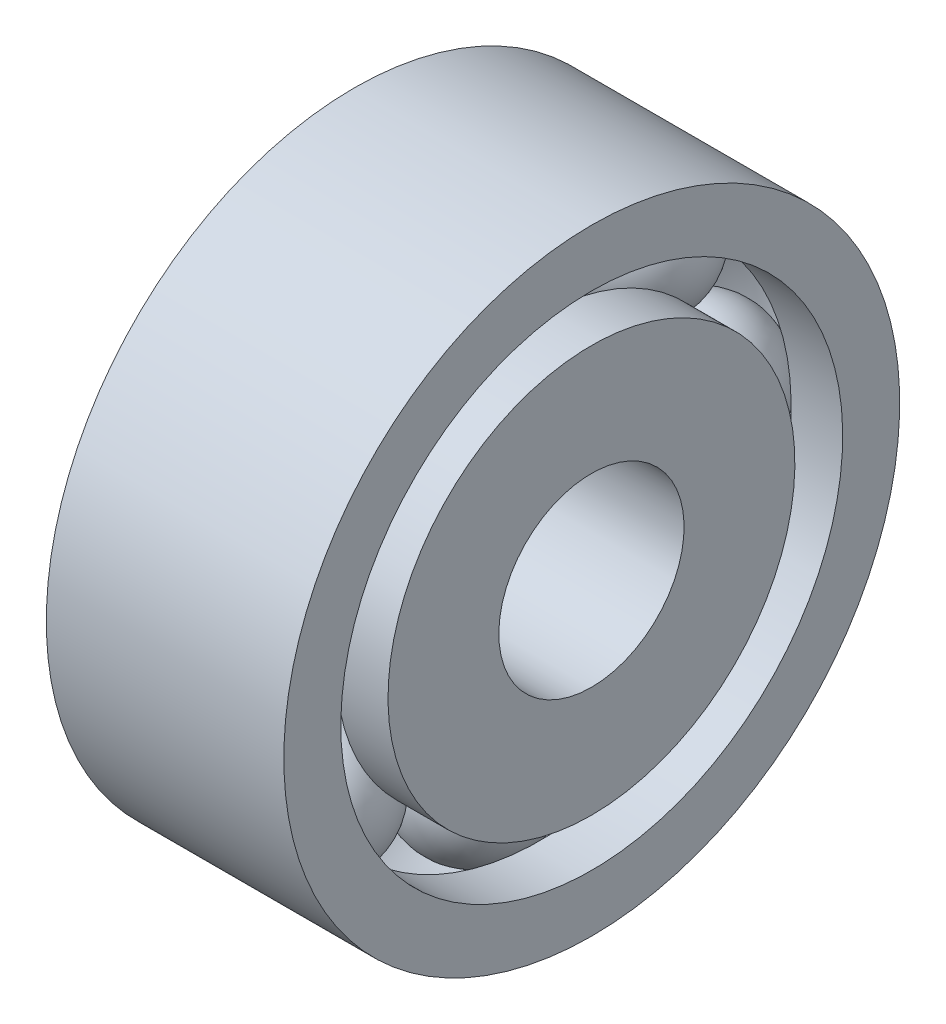
from build123d import *

# Parameters (mm, degrees)
CIRPATTERN2_COUNT = 8


with BuildPart() as part:
    # Sketch1 → Revolve1 (revolve)
    with BuildSketch(Plane.XY):
        with BuildLine():
            Line((-6.333758795, 16.466511751), (-6.333758795, 13.418511751))
            Line((-6.333758795, 13.418511751), (-4.843515161, 13.418511751))
            Line((-4.843515161, 13.418511751), (-3.575861243, 13.418511751))
            ThreePointArc((-3.575861243, 13.418511751), (0.016241205, 15.958511751), (3.608343654, 13.418511751))
            Line((3.608343654, 13.418511751), (4.875997572, 13.418511751))
            Line((4.875997572, 13.418511751), (6.366241205, 13.418511751))
            Line((6.366241205, 13.418511751), (6.366241205, 16.466511751))
            Line((6.366241205, 16.466511751), (-6.333758795, 16.466511751))
        make_face()
    revolve(axis=Axis((-6.333758795, 0, 0), (1, 0, 0)))


with BuildPart() as body_2:
    # Sketch4 → Revolve2 (revolve)
    with BuildSketch(Plane.XY):
        with BuildLine():
            Line((-6.35, 10.878511644), (-6.35, 4.953))
            Line((-6.35, 4.953), (6.35, 4.953))
            Line((6.35, 4.953), (6.35, 10.878511644))
            Line((6.35, 10.878511644), (3.592102448, 10.878511644))
            ThreePointArc((3.592102448, 10.878511644), (0, 8.338511644), (-3.592102448, 10.878511644))
            Line((-3.592102448, 10.878511644), (-6.35, 10.878511644))
        make_face()
    revolve(axis=Axis((6.35, 0, 0), (-1, 0, 0)))


with BuildPart() as body_3:
    # Sketch5 → Revolve5 (revolve)
    with BuildSketch(Plane.XY):
        with BuildLine():
            Line((0, 8.529011644), (0, 15.768011644))
            ThreePointArc((0, 15.768011644), (3.6195, 12.148511644), (0, 8.529011644))
        make_face()
    revolve(axis=Axis((0, 0, 0), (0, 1, 0)))


with BuildPart() as cirpattern2_1:
    # CirPattern2: pattern copy
    add(body_3.part.rotate(Axis((6.35, 0, 0), (-1, 0, 0)), 1 * 360 / CIRPATTERN2_COUNT))


with BuildPart() as cirpattern2_2:
    # CirPattern2: pattern copy
    add(body_3.part.rotate(Axis((6.35, 0, 0), (-1, 0, 0)), 2 * 360 / CIRPATTERN2_COUNT))


with BuildPart() as cirpattern2_3:
    # CirPattern2: pattern copy
    add(body_3.part.rotate(Axis((6.35, 0, 0), (-1, 0, 0)), 3 * 360 / CIRPATTERN2_COUNT))


with BuildPart() as cirpattern2_4:
    # CirPattern2: pattern copy
    add(body_3.part.rotate(Axis((6.35, 0, 0), (-1, 0, 0)), 4 * 360 / CIRPATTERN2_COUNT))


with BuildPart() as cirpattern2_5:
    # CirPattern2: pattern copy
    add(body_3.part.rotate(Axis((6.35, 0, 0), (-1, 0, 0)), 5 * 360 / CIRPATTERN2_COUNT))


with BuildPart() as cirpattern2_6:
    # CirPattern2: pattern copy
    add(body_3.part.rotate(Axis((6.35, 0, 0), (-1, 0, 0)), 6 * 360 / CIRPATTERN2_COUNT))


with BuildPart() as cirpattern2_7:
    # CirPattern2: pattern copy
    add(body_3.part.rotate(Axis((6.35, 0, 0), (-1, 0, 0)), 7 * 360 / CIRPATTERN2_COUNT))


solid = Compound([part.part, body_2.part, body_3.part, cirpattern2_1.part, cirpattern2_2.part, cirpattern2_3.part, cirpattern2_4.part, cirpattern2_5.part, cirpattern2_6.part, cirpattern2_7.part])
